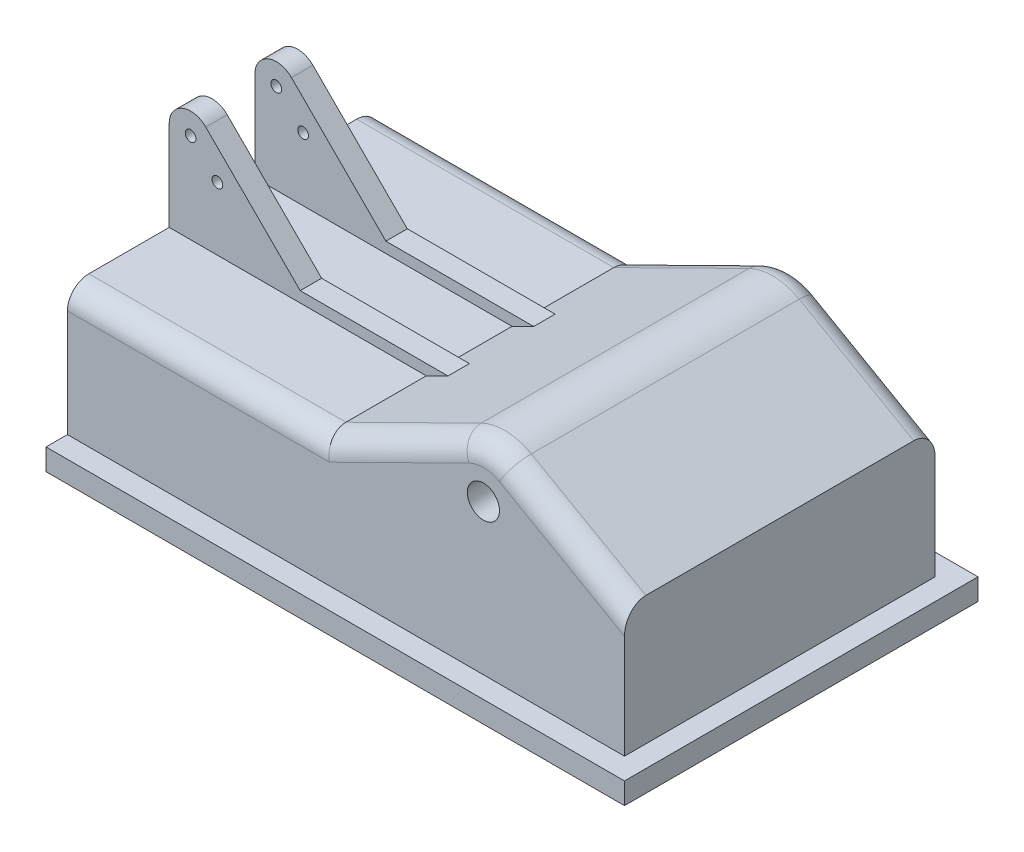
from build123d import *

# Parameters (mm, degrees)
SKETCH1_R           = 15
BOSS_EXTRUDE1_DEPTH = 145
BOSS_EXTRUDE2_START = 30
SKETCH2_R           = 5
BOSS_EXTRUDE2_DEPTH = 20
SHELL1_START        = -125
SHELL1_DEPTH        = 250
SKETCH3_W           = 520
SKETCH3_H           = 290
BOSS_EXTRUDE3_DEPTH = 20
FILLET1_R           = 20


# Read off the part's stored shape, not the designer's step: Shell1
with BuildPart() as part:
    # Sketch1 → Boss-Extrude1 (new, symmetric)
    with BuildSketch(Plane.XY):
        with BuildLine():
            Line((-260, 0), (260, 0))
            Line((260, 0), (260, 120))
            Line((260, 120), (153.093568272, 180.972007347))
            ThreePointArc((153.093568272, 180.972007347), (129.803653925, 187.517381697), (106.167012988, 182.362651739))
            Line((106.167012988, 182.362651739), (-20, 120))
            Line((-20, 120), (-260, 120))
            Line((-260, 120), (-260, 0))
        make_face()
        with Locations((128.322579774, 140)):
            Circle(SKETCH1_R, mode=Mode.SUBTRACT)
    extrude(amount=BOSS_EXTRUDE1_DEPTH, both=True)

    # Sketch2 → Boss-Extrude2 (add)
    with BuildSketch(Plane.XY.offset(BOSS_EXTRUDE2_START)):
        with BuildLine():
            Line((-260, 120), (-260, 204))
            ThreePointArc((-260, 204), (-247.653668647, 222.47759065), (-225.857864376, 218.142135624))
            Line((-225.857864376, 218.142135624), (-137.715728753, 130))
            Line((-137.715728753, 130), (0.23118156, 130))
            Line((0.23118156, 130), (-20, 120))
            Line((-20, 120), (-260, 120))
        make_face()
        with Locations((-240, 204)):
            Circle(SKETCH2_R, mode=Mode.SUBTRACT)
        with Locations((-215, 179)):
            Circle(SKETCH2_R, mode=Mode.SUBTRACT)
    boss_extrude2 = extrude(amount=BOSS_EXTRUDE2_DEPTH)

    # Mirror1: Boss-Extrude2 across plane
    add(boss_extrude2.mirror(Plane.XY))

    # Shell1 outline → Shell1 (cut)
    with BuildSketch(Plane.XY.offset(SHELL1_START)):
        with BuildLine():
            Line((96.937260838, 155.490698991), (-15.32697978, 100))
            Line((-15.32697978, 100), (-240, 100))
            Line((-240, 100), (-240, 0))
            Line((-240, 0), (240, 0))
            Line((240, 0), (240, 108.382476706))
            Line((240, 108.382476706), (160.526102167, 153.708871052))
            ThreePointArc((160.526102167, 153.708871052), (127.342226815, 105.013732579), (96.937260838, 155.490698991))
        make_face()
    extrude(amount=SHELL1_DEPTH, mode=Mode.SUBTRACT)

    # Sketch3 → Boss-Extrude3 (add)
    # profile 1 of 2: a face of its own
    with BuildSketch(Plane.XZ):
        Rectangle(SKETCH3_W, SKETCH3_H)
        Polygon((160.526102167, -125), (-240, -125), (-240, 125), (-15.32697978, 125), (93.322579774, 125), (96.937260838, 125), (163.322579774, 125), (240, 125), (240, -125), align=None, mode=Mode.SUBTRACT)
    # profile 2 of 2: a face of its own
    with BuildSketch(Plane.XZ):
        Polygon((280, 165), (-260, 165), (-260, 145), (260, 145), (260, -145), (-260, -145), (-260, -165), (280, -165), align=None)
    extrude(amount=BOSS_EXTRUDE3_DEPTH)

    # Fillet1
    fillet1_edges = [part.edges().sort_by_distance(p)[0] for p in [
        (129.803653925, 187.517381697, -145),
        (-140, 120, 145),
        (206.546784136, 150.486003673, 145),
        (129.803653925, 187.517381697, 145),
        (206.546784136, 150.486003673, -145),
        (43.083506494, 151.181325869, 145),
        (-140, 120, -145),
        (43.083506494, 151.181325869, -145),
    ]]
    fillet(fillet1_edges, radius=FILLET1_R)


solid = part.part
